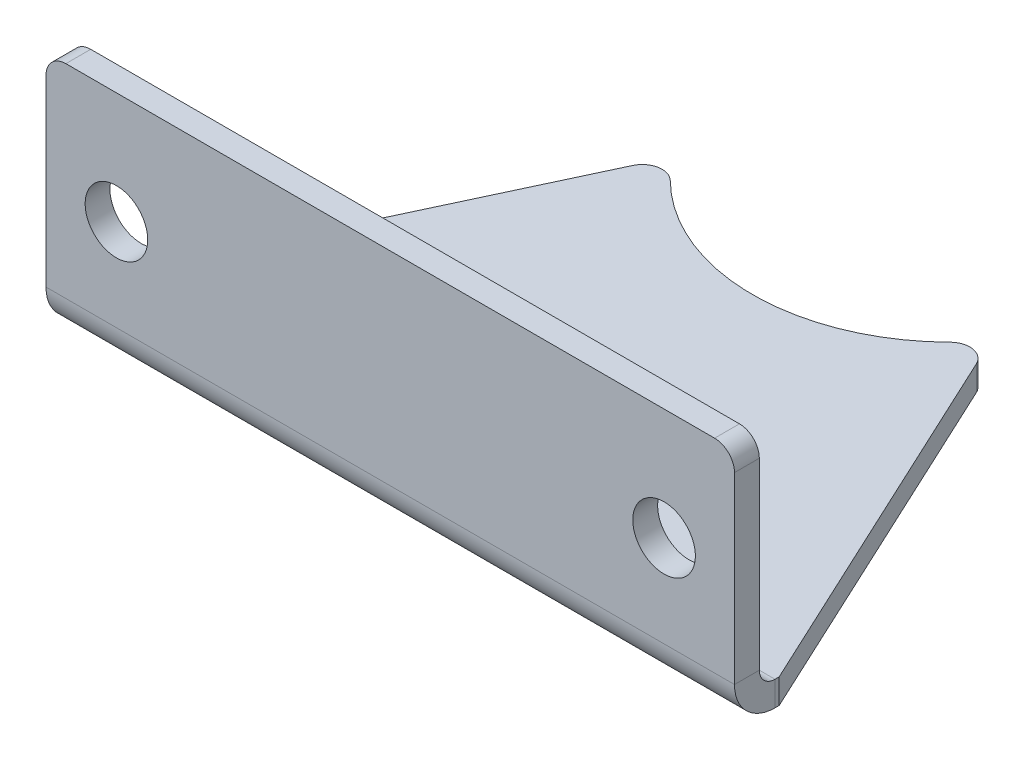
from build123d import *

# Parameters (mm, degrees)
BASE_FLANGE2_DEPTH = 1.5875
EDGE_FLANGE2_DEPTH = 43.999999884
FILLET2_R          = 1.27
SKETCH21_R         = 2
CUT_EXTRUDE1_DEPTH = 37.554305105


# Sheet-metal steps are written as plain solids
with BuildPart() as part:
    # Sketch12 → Base-Flange2 (new body)
    with BuildSketch(Plane(origin=(0, 0, 0), x_dir=(1, 0, 0), z_dir=(0, 1, 0))):
        with BuildLine():
            Line((-21.999999942, -33), (0, -33))
            Line((0, -33), (21.999999942, -33))
            Line((21.999999942, -33), (10.16, -7.62))
            ThreePointArc((10.16, -7.62), (0, -12.7), (-10.16, -7.62))
            Line((-10.16, -7.62), (-21.999999942, -33))
        make_face()
    extrude(amount=-BASE_FLANGE2_DEPTH)

    # Edge-Flange2 section (across the edge) → Edge-Flange2 (add)
    with BuildSketch(Plane(origin=(-21.999999942, 0, 34.27), x_dir=(0, 0, -1), z_dir=(1, 0, 0))):
        with BuildLine():
            Line((-1.5875, 1), (-1.5875, 14))
            Line((-1.5875, 14), (0, 14))
            Line((0, 14), (0, 1))
            ThreePointArc((0, 1), (0.292893219, 0.292893219), (1, 0))
            Line((1, 0), (1.27, 0))
            Line((1.27, 0), (1.27, -1.5875))
            Line((1.27, -1.5875), (1, -1.5875))
            ThreePointArc((1, -1.5875), (-0.829638796, -0.829638796), (-1.5875, 1))
        make_face()
    extrude(amount=EDGE_FLANGE2_DEPTH)

    # Fillet2
    fillet2_edges = [part.edges().sort_by_distance(p)[0] for p in [
        (-21.999999942, 14, 35.06375),
        (21.999999942, 14, 35.06375),
        (-10.16, -0.79375, 7.62),
        (10.16, -0.79375, 7.62),
    ]]
    fillet(fillet2_edges, radius=FILLET2_R)

    # Sketch21 → Cut-Extrude1 (cut, through all)
    with BuildSketch(Plane(origin=(0, 0, 34.27), x_dir=(-1, 0, 0), z_dir=(0, 0, -1))):
        with Locations((-17.5, 6.865)):
            Circle(SKETCH21_R)
        with Locations((17.5, 6.865)):
            Circle(SKETCH21_R)
    extrude(amount=-CUT_EXTRUDE1_DEPTH, mode=Mode.SUBTRACT)


solid = part.part
